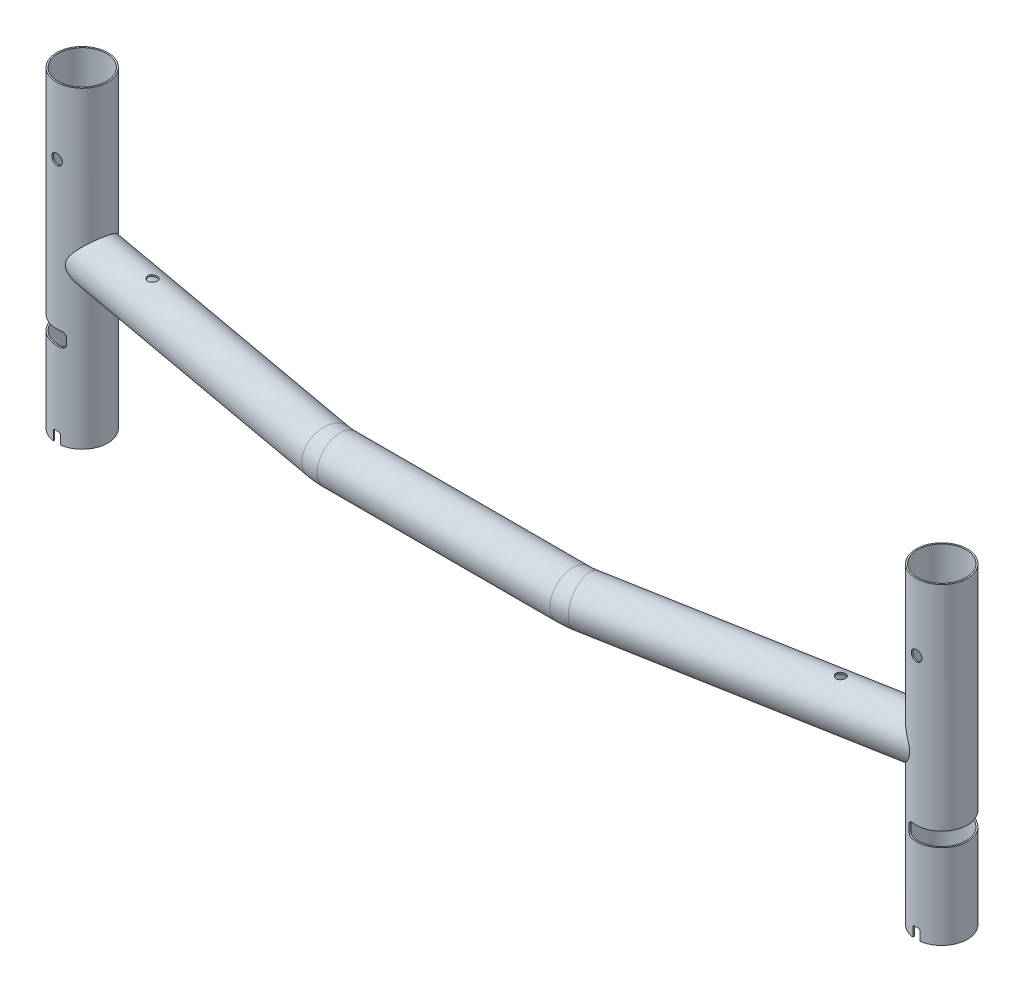
from build123d import *

# Parameters (mm, degrees)
SKETCH2_R               = 12.7
SKETCH2_R_2             = 11.899999999999999
BOSS_EXTRUDE1_START     = -88
SKETCH3_R               = 14.299999999999955
SKETCH3_R_2             = 13.500000000000002
BOSS_EXTRUDE1_DEPTH     = 174.5
SKETCH4_R               = 13.500000000000002
CUT_EXTRUDE1_DEPTH      = 312.6540844742015
SKETCH5_R               = 11.9
CUT_EXTRUDE2_DEPTH      = 88
CUT_EXTRUDE3_DEPTH      = 20
CUT_EXTRUDE5_REACH      = 274.804
CUT_EXTRUDE5_END_RADIUS = 13.5
CUT_EXTRUDE4_REACH      = 274.804
SKETCH8_R               = 2.9999999999999947
SKETCH10_R              = 2.9499999999999975
CUT_EXTRUDE6_DEPTH      = 273.8039925517087
CUT_EXTRUDE7_DEPTH      = 273.8039925517087
CUT_EXTRUDE7_DEPTH_BACK = 273.8039925517087
SKETCH11_R              = 2.599999999999989
SKETCH11_R_2            = 2.599999999999936


with BuildPart() as part:
    # Sweep1: sweep along a path in Sketch1
    with BuildLine(Plane(origin=(0, 0, 0), x_dir=(1, 0, 0), z_dir=(0, 1, 0))) as sweep1_path:
        Line((234, 30), (72.13858861003506, 0.6421475095924819))
        ThreePointArc((72.13858861003506, 0.6421475095924819), (68.58370620891968, 0.16086032796202687), (65, 0))
        Line((65, 0), (-65, 0))
        ThreePointArc((-65, 0), (-68.58370620891968, 0.16086032796202687), (-72.13858861003506, 0.6421475095924819))
        Line((-72.13858861003506, 0.6421475095924819), (-234, 30))
    # Sketch2 → Sweep1 (sweep)
    with BuildSketch(Plane(origin=(234.00000000000003, 0, -30.000000000000007), x_dir=(-0.1784647152508764, 0, -0.9839463122601881), z_dir=(0.9839463122601881, 0, -0.1784647152508764))):
        Circle(SKETCH2_R)
        Circle(SKETCH2_R_2, mode=Mode.SUBTRACT)
    sweep(path=sweep1_path.line)

    # Sketch3 → Boss-Extrude1 (add)
    with BuildSketch(Plane(origin=(0, 0, 0), x_dir=(1, 0, 0), z_dir=(0, 1, 0)).offset(BOSS_EXTRUDE1_START)):
        with Locations((239.9036778735612, 31.070788291505277)):
            Circle(SKETCH3_R)
        with Locations((239.9036778735612, 31.070788291505277)):
            Circle(SKETCH3_R_2, mode=Mode.SUBTRACT)
    boss_extrude1 = extrude(amount=BOSS_EXTRUDE1_DEPTH)

    # Sketch4 → Cut-Extrude1 (cut, through all)
    with BuildSketch(Plane.XZ.offset(88)):
        with Locations((239.9036778735612, -31.070788291505277)):
            Circle(SKETCH4_R)
    cut_extrude1 = extrude(amount=-CUT_EXTRUDE1_DEPTH, mode=Mode.SUBTRACT)

    # Sketch5 → Cut-Extrude2 (cut)
    with BuildSketch(Plane(origin=(234.00000000000003, 0, -30.000000000000007), x_dir=(-0.1784647152508764, 0, -0.9839463122601881), z_dir=(0.9839463122601881, 0, -0.1784647152508764))):
        with Locations((-0.01488844486755708, 0)):
            Circle(SKETCH5_R)
    cut_extrude2 = extrude(amount=-CUT_EXTRUDE2_DEPTH, mode=Mode.SUBTRACT)

    # Sketch7 → Cut-Extrude3 (cut, symmetric)
    with BuildSketch(Plane(origin=(239.90367787356124, 86.5, -31.07078829150528), x_dir=(-0.9413548600027752, 0, -0.33741817904368404), z_dir=(0.33741817904368404, 0, -0.9413548600027752))):
        with BuildLine():
            Line((-12.700000000000045, -119.23057124999997), (-27.494203982349365, -119.23057124999997))
            Line((-27.494203982349365, -119.23057124999997), (-27.49420398234936, -127.23057124999998))
            Line((-27.49420398234936, -127.23057124999998), (-12.700000000000045, -127.23057124999998))
            Line((-12.700000000000045, -127.23057124999998), (-2.499999999999999, -127.23057124999998))
            ThreePointArc((-2.499999999999999, -127.23057124999998), (-0.7322330470336309, -126.49833820296635), (5e-17, -124.73057124999998))
            Line((5e-17, -124.73057124999998), (-8.7e-16, -121.73057124999997))
            ThreePointArc((-8.7e-16, -121.73057124999997), (-0.732233047033632, -119.9628042970336), (-2.5000000000000004, -119.23057124999995))
            Line((-2.5000000000000004, -119.23057124999995), (-12.700000000000045, -119.23057124999997))
        make_face()
    cut_extrude3 = extrude(amount=CUT_EXTRUDE3_DEPTH, both=True, mode=Mode.SUBTRACT)

    # Cut-Extrude5: up to this cylinder (the profile starts outside it)
    cut_extrude5_end = Plane(origin=(239.9036778735612, -88.052119, -31.070788291505277), z_dir=(0, 1, 0)) * Cylinder(CUT_EXTRUDE5_END_RADIUS, 577.608, mode=Mode.PRIVATE)
    # Sketch9 → Cut-Extrude5 (cut, up to the surface)
    with BuildSketch(Plane.XY, mode=Mode.PRIVATE) as cut_extrude5_sk1:
        with BuildLine():
            Line((238.9036778735612, -82), (240.9036778735612, -82))
            ThreePointArc((240.9036778735612, -82), (241.61078465474776, -82.29289321881345), (241.9036778735612, -83))
            Line((241.9036778735612, -83), (241.9036778735612, -94))
            Line((241.9036778735612, -94), (237.9036778735612, -94))
            Line((237.9036778735612, -94), (237.9036778735612, -83))
            ThreePointArc((237.9036778735612, -83), (238.19657109237465, -82.29289321881345), (238.9036778735612, -82))
        make_face()
    cut_extrude5_tool1 = extrude(cut_extrude5_sk1.sketch, amount=-CUT_EXTRUDE5_REACH, mode=Mode.PRIVATE) - cut_extrude5_end
    cut_extrude5 = cut_extrude5_tool1.solids().sort_by_distance((239.903678, -88.052119, 0))[0]
    add(cut_extrude5, mode=Mode.SUBTRACT)

    # Mirror1: Boss-Extrude1, Cut-Extrude1, Cut-Extrude2, Cut-Extrude3, Cut-Extrude5 across plane
    add(boss_extrude1.mirror(Plane(origin=(0, 0, 0), x_dir=(0, 0, 1), z_dir=(1, 0, 0))))
    add(cut_extrude1.mirror(Plane(origin=(0, 0, 0), x_dir=(0, 0, 1), z_dir=(1, 0, 0))), mode=Mode.SUBTRACT)
    add(cut_extrude2.mirror(Plane(origin=(0, 0, 0), x_dir=(0, 0, 1), z_dir=(1, 0, 0))), mode=Mode.SUBTRACT)
    add(cut_extrude3.mirror(Plane(origin=(0, 0, 0), x_dir=(0, 0, 1), z_dir=(1, 0, 0))), mode=Mode.SUBTRACT)
    add(cut_extrude5.mirror(Plane(origin=(0, 0, 0), x_dir=(0, 0, 1), z_dir=(1, 0, 0))), mode=Mode.SUBTRACT)

    # Sketch8 → Cut-Extrude4 (cut, up to next)
    with BuildSketch(Plane(origin=(0, 0, 0), x_dir=(1, 0, 0), z_dir=(0, 1, 0)), mode=Mode.PRIVATE) as cut_extrude4_sk1:
        with Locations((216.9875163818188, 26.593661315401395)):
            Circle(SKETCH8_R)
    cut_extrude4_tool1 = extrude(cut_extrude4_sk1.sketch, amount=-CUT_EXTRUDE4_REACH, mode=Mode.PRIVATE) & part.part
    add(cut_extrude4_tool1.solids().sort_by_distance((216.987516, 0, -26.593661))[0], mode=Mode.SUBTRACT)

    # Sketch10 → Cut-Extrude6 (cut, symmetric)
    with BuildSketch(Plane.XY):
        with Locations((-239.9036778735612, 49.199999999999996)):
            Circle(SKETCH10_R)
    cut_extrude6 = extrude(amount=CUT_EXTRUDE6_DEPTH, both=True, mode=Mode.SUBTRACT)

    # Sketch11 → Cut-Extrude7 (cut, two sides: drawn at the far end of the back side and taken through both)
    with BuildSketch(Plane(origin=(0, 0, 0), x_dir=(1, 0, 0), z_dir=(0, 1, 0)).offset(-CUT_EXTRUDE7_DEPTH_BACK)):
        with Locations((192.08420105567154, 22.57589065136944)):
            Circle(SKETCH11_R)
        with Locations((-192.08420105567154, 22.57589065136944)):
            Circle(SKETCH11_R_2)
    extrude(amount=CUT_EXTRUDE7_DEPTH + CUT_EXTRUDE7_DEPTH_BACK, mode=Mode.SUBTRACT)

    # Mirror2: Cut-Extrude6 across plane
    add(cut_extrude6.mirror(Plane(origin=(0, 0, 0), x_dir=(0, 0, 1), z_dir=(1, 0, 0))), mode=Mode.SUBTRACT)


solid = part.part
